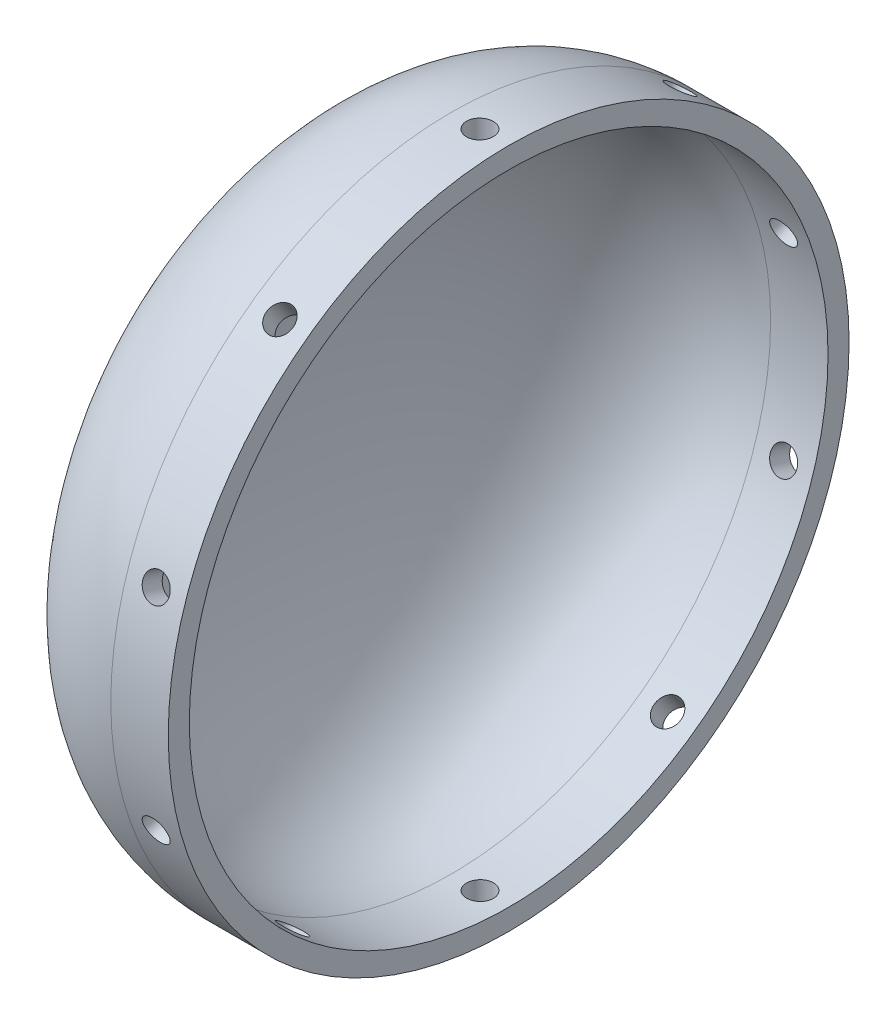
from build123d import *

# Parameters (mm, degrees)
SKETCH2_R          = 7
CUT_EXTRUDE1_DEPTH = 284.064798407
CIRPATTERN1_COUNT  = 10


with BuildPart() as part:
    # Sketch1 → Revolve1 (revolve)
    with BuildSketch(Plane.XY):
        with BuildLine():
            Line((-30, 177.8), (0, 177.8))
            Line((0, 177.8), (0, 166.8))
            Line((0, 166.8), (-30, 166.8))
            add(Edge.make_bspline(
                [(-119, 0), (-119, 2.771642527), (-118.951737382, 8.325010146), (-118.65679253, 19.348516671), (-117.90617327, 32.978509093), (-116.363968307, 48.950764847), (-113.415584603, 69.565767867), (-107.993241038, 93.723656132), (-98.566036378, 119.069208086), (-88.275023862, 136.287590543), (-78.640888507, 147.333579738), (-70.714147416, 154.21137799), (-62.04242488, 159.663868387), (-54.103750393, 163.009674312), (-47.241626147, 164.938635739), (-41.819154739, 165.997082798), (-37.045497933, 166.54094765), (-33.081482801, 166.762421555), (-31.020772238, 166.8), (-30, 166.8)],
                knots=[0, 0, 0, 0, 0.03125, 0.0625, 0.125, 0.1875, 0.25, 0.375, 0.5, 0.625, 0.6875, 0.75, 0.8125, 0.875, 0.90625, 0.9375, 0.96875, 0.984375, 1, 1, 1, 1], degree=3))
            Line((-119, 0), (-130, 0))
            add(Edge.make_bspline(
                [(-130, 0), (-130, 90.918718872), (-104.72426119, 177.8), (-30, 177.8)],
                knots=[0, 0, 0, 0, 1, 1, 1, 1], degree=3))
        make_face()
    revolve(axis=Axis((0, 0, 0), (-1, 0, 0)))

    # Sketch2 → Cut-Extrude1 (cut, through all)
    with BuildSketch(Plane(origin=(0, 0, 0), x_dir=(1, 0, 0), z_dir=(0, 1, 0))):
        with Locations((-15, 0)):
            Circle(SKETCH2_R)
    cut_extrude1 = extrude(amount=-CUT_EXTRUDE1_DEPTH, mode=Mode.SUBTRACT)

    # CirPattern1: Cut-Extrude1 ×10 about axis
    cirpattern1_axis = Axis((-30, 0, 0), (1, 0, 0))
    for i in range(1, CIRPATTERN1_COUNT):
        add(cut_extrude1.rotate(cirpattern1_axis, i * 360 / CIRPATTERN1_COUNT), mode=Mode.SUBTRACT)


solid = part.part
